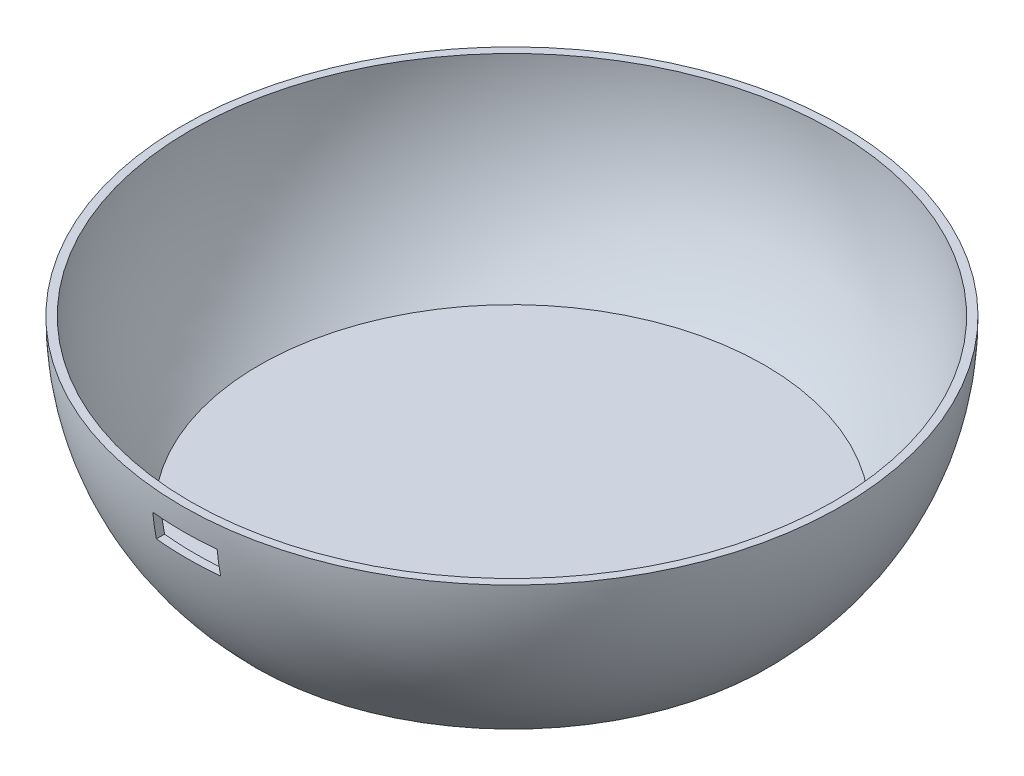
from build123d import *

# Parameters (mm, degrees)
SHELL2_T           = -1
CUT_EXTRUDE2_DEPTH = 95.281493566


with BuildPart() as part:
    # Sketch1 → Revolve1 (revolve)
    with BuildSketch(Plane.XY):
        with BuildLine():
            Line((0, 0), (41, 0))
            Line((41, 0), (41, -22))
            Line((41, -22), (9.159670332, -22))
            ThreePointArc((9.159670332, -22), (2.381385256, -11.915321655), (0, 0))
        make_face()
    revolve(axis=Axis((41, 0, 0), (0, -1, 0)))

    # Shell2
    shell2_openings = [part.faces().sort_by_distance(p)[0] for p in [
        (41, 0, 0),
    ]]
    offset(amount=SHELL2_T, openings=shell2_openings, kind=Kind.INTERSECTION)

    # Sketch8 → Cut-Extrude2 (cut, through all)
    with BuildSketch(Plane.XY):
        Polygon((41, -2.8), (45, -2.8), (45, -5.9), (37, -5.9), (37, -2.8), align=None)
    extrude(amount=CUT_EXTRUDE2_DEPTH, mode=Mode.SUBTRACT)


solid = part.part
